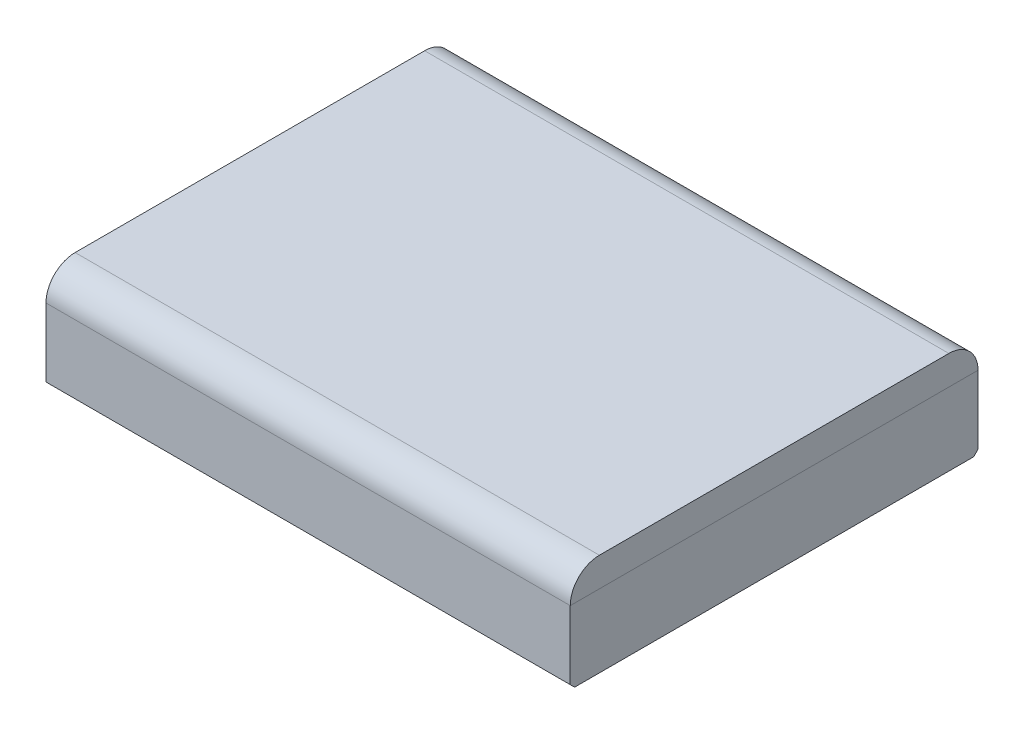
from build123d import *

# Parameters (mm, degrees)
CASEEXTRUDE_DEPTH      = 180
SHELL1_T               = 3
SCREWBOSSEXTRUDE_REACH = 232.269
INTERNALFILLET_R       = 1


# Read off the part's stored shape, not the designer's step: Split3
with BuildPart() as part:
    # Sketch1 → CaseExtrude (new body)
    with BuildSketch(Plane(origin=(0, 0, 0), x_dir=(0, 0, -1), z_dir=(1, 0, 0))):
        with BuildLine():
            Line((1.5, 0), (0, 1.5))
            Line((0, 1.5), (0, 25))
            ThreePointArc((0, 25), (2.928932188, 32.071067812), (10, 35))
            Line((10, 35), (130, 35))
            ThreePointArc((130, 35), (137.071067812, 32.071067812), (140, 25))
            Line((140, 25), (140, 1.5))
            Line((140, 1.5), (138.5, 0))
            Line((138.5, 0), (1.5, 0))
        make_face()
    extrude(amount=CASEEXTRUDE_DEPTH)

    # Shell1 (no face opened: a closed hollow body)
    add(offset(amount=-SHELL1_T, mode=Mode.PRIVATE), mode=Mode.SUBTRACT)

    # Sketch5 → ScrewBossExtrude (add, up to next)
    with BuildSketch(Plane(origin=(0, 3, 0), x_dir=(1, 0, 0), z_dir=(0, 1, 0)), mode=Mode.PRIVATE) as screwbossextrude_sk1:
        with BuildLine():
            Line((3, 137), (15, 137))
            Line((15, 137), (15, 131))
            ThreePointArc((15, 131), (13.242640687, 126.757359313), (9, 125))
            Line((9, 125), (3, 125))
            Line((3, 125), (3, 137))
        make_face()
    screwbossextrude_tool1 = extrude(screwbossextrude_sk1.sketch, amount=SCREWBOSSEXTRUDE_REACH, mode=Mode.PRIVATE) - part.part
    # Sketch5 → ScrewBossExtrude (add, up to next)
    with BuildSketch(Plane(origin=(0, 3, 0), x_dir=(1, 0, 0), z_dir=(0, 1, 0)), mode=Mode.PRIVATE) as screwbossextrude_sk2:
        with BuildLine():
            Line((3, 3), (15, 3))
            Line((15, 3), (15, 9))
            ThreePointArc((15, 9), (13.242640687, 13.242640687), (9, 15))
            Line((9, 15), (3, 15))
            Line((3, 15), (3, 3))
        make_face()
    screwbossextrude_tool2 = extrude(screwbossextrude_sk2.sketch, amount=SCREWBOSSEXTRUDE_REACH, mode=Mode.PRIVATE) - part.part
    # Sketch5 → ScrewBossExtrude (add, up to next)
    with BuildSketch(Plane(origin=(0, 3, 0), x_dir=(1, 0, 0), z_dir=(0, 1, 0)), mode=Mode.PRIVATE) as screwbossextrude_sk3:
        with BuildLine():
            Line((177, 3), (165, 3))
            Line((165, 3), (165, 9))
            ThreePointArc((165, 9), (166.757359313, 13.242640687), (171, 15))
            Line((171, 15), (177, 15))
            Line((177, 15), (177, 3))
        make_face()
    screwbossextrude_tool3 = extrude(screwbossextrude_sk3.sketch, amount=SCREWBOSSEXTRUDE_REACH, mode=Mode.PRIVATE) - part.part
    # Sketch5 → ScrewBossExtrude (add, up to next)
    with BuildSketch(Plane(origin=(0, 3, 0), x_dir=(1, 0, 0), z_dir=(0, 1, 0)), mode=Mode.PRIVATE) as screwbossextrude_sk4:
        with BuildLine():
            Line((177, 137), (165, 137))
            Line((165, 137), (165, 131))
            ThreePointArc((165, 131), (166.757359313, 126.757359313), (171, 125))
            Line((171, 125), (177, 125))
            Line((177, 125), (177, 137))
        make_face()
    screwbossextrude_tool4 = extrude(screwbossextrude_sk4.sketch, amount=SCREWBOSSEXTRUDE_REACH, mode=Mode.PRIVATE) - part.part
    add(screwbossextrude_tool1.solids().sort_by_distance((8.735827, 3, -131.264173))[0])
    add(screwbossextrude_tool2.solids().sort_by_distance((8.735827, 3, -8.735827))[0])
    add(screwbossextrude_tool3.solids().sort_by_distance((171.264173, 3, -8.735827))[0])
    add(screwbossextrude_tool4.solids().sort_by_distance((171.264173, 3, -131.264173))[0])

    # InternalFillet
    internalfillet_edges = [part.edges().sort_by_distance(p)[0] for p in [
        (177, 17.5, -125),
        (174, 32, -125),
        (167.127016654, 32, -126.417424305),
        (165.020908991, 31.982153697, -130.499529468),
        (165, 29.582575695, -135.291502622),
        (165, 14, -137),
        (165, 14, -3),
        (165, 29.582575695, -4.708497378),
        (165.020908991, 31.982153697, -9.500470532),
        (167.127016654, 32, -13.582575695),
        (174, 32, -15),
        (177, 17.5, -15),
        (3, 17.5, -15),
        (6, 32, -15),
        (12.872983346, 32, -13.582575695),
        (14.979091009, 31.982153697, -9.500470532),
        (15, 29.582575695, -4.708497378),
        (15, 14, -3),
        (15, 14, -137),
        (15, 29.582575695, -135.291502622),
        (14.979091009, 31.982153697, -130.499529468),
        (12.872983346, 32, -126.417424305),
        (6, 32, -125),
        (3, 17.5, -125),
    ]]
    fillet(internalfillet_edges, radius=INTERNALFILLET_R)


with BuildPart() as body_2:
    # Split3: the piece on the far side of the plane
    add(part.part)
    split(bisect_by=Plane(origin=(0, 25, 0), x_dir=(1, 0, 0), z_dir=(0, 1, 0)), keep=Keep.BOTTOM)


with BuildPart() as part_1:
    add(part.part)

    # Split3
    split(bisect_by=Plane(origin=(0, 25, 0), x_dir=(1, 0, 0), z_dir=(0, 1, 0)), keep=Keep.TOP)


solid = Compound([body_2.part, part_1.part])
